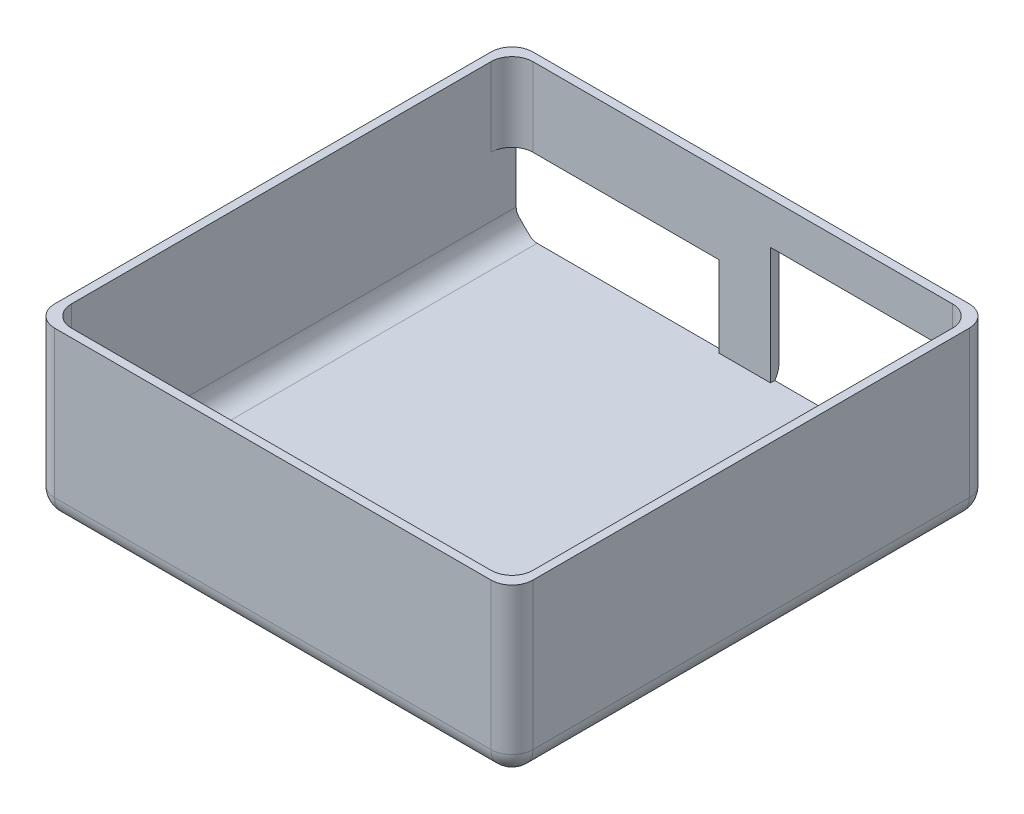
from build123d import *

# Parameters (mm, degrees)
SKETCH1_W           = 114
SKETCH1_H           = 114
SKETCH1_W_2         = 110
SKETCH1_H_2         = 110
BOSS_EXTRUDE1_DEPTH = 2
SKETCH1_3_W         = 114
SKETCH1_3_H         = 114
SKETCH1_3_W_2       = 110
SKETCH1_3_H_2       = 110
BOSS_EXTRUDE2_DEPTH = 40
SKETCH2_W           = 48.37766652
SKETCH2_H           = 27.964547649
SKETCH2_W_2         = 49.350090125
SKETCH2_H_2         = 19.287013153
CUT_EXTRUDE1_DEPTH  = 132.882523482
FILLET1_R           = 5
FILLET2_R           = 5


with BuildPart() as part:
    # Sketch1 → Boss-Extrude1 (new body)
    # profile 1 of 2: a face of its own
    with BuildSketch(Plane(origin=(0, 0, 0), x_dir=(1, 0, 0), z_dir=(0, 1, 0))):
        Rectangle(SKETCH1_W, SKETCH1_H)
        Rectangle(SKETCH1_W_2, SKETCH1_H_2, mode=Mode.SUBTRACT)
    # profile 2 of 2: a face of its own
    with BuildSketch(Plane(origin=(0, 0, 0), x_dir=(1, 0, 0), z_dir=(0, 1, 0))):
        Rectangle(SKETCH1_W_2, SKETCH1_H_2)
    extrude(amount=BOSS_EXTRUDE1_DEPTH)

    # Sketch1<3> → Boss-Extrude2 (add)
    with BuildSketch(Plane(origin=(0, 0, 0), x_dir=(1, 0, 0), z_dir=(0, 1, 0))):
        Rectangle(SKETCH1_3_W, SKETCH1_3_H)
        Rectangle(SKETCH1_3_W_2, SKETCH1_3_H_2, mode=Mode.SUBTRACT)
    extrude(amount=BOSS_EXTRUDE2_DEPTH)

    # Sketch2 → Cut-Extrude1 (cut, through all)
    with BuildSketch(Plane.XY.offset(-55)):
        with Locations((30.81116674, 15.982273825)):
            Rectangle(SKETCH2_W, SKETCH2_H)
        with Locations((-30.324954937, 11.643506577)):
            Rectangle(SKETCH2_W_2, SKETCH2_H_2)
    extrude(amount=-CUT_EXTRUDE1_DEPTH, mode=Mode.SUBTRACT)

    # Fillet1
    # the kernel refuses this fillet: 5 mm, written as the material it adds along each edge
    with BuildSketch(Plane(origin=(50, 7, 50), x_dir=(0, 0, 1), z_dir=(0, -1, 0))) as fillet1_piece_1_section:
        Polygon((0, 0), (FILLET1_R, 0), (FILLET1_R, -FILLET1_R), (0, -FILLET1_R), align=None)
    fillet1_piece_1 = extrude(amount=FILLET1_R, mode=Mode.PRIVATE)
    fillet1_piece_1 = fillet1_piece_1 - Plane(origin=(50, 7, 50), x_dir=(-0.7071067811865477, 0, -0.7071067811865475), z_dir=(0, -1, 0)) * Sphere(FILLET1_R, mode=Mode.PRIVATE)
    add(fillet1_piece_1)
    with BuildSketch(Plane(origin=(-50, 7, 50), x_dir=(-1, 0, 0), z_dir=(0, -1, 0))) as fillet1_piece_2_section:
        Polygon((0, 0), (FILLET1_R, 0), (FILLET1_R, -FILLET1_R), (0, -FILLET1_R), align=None)
    fillet1_piece_2 = extrude(amount=FILLET1_R, mode=Mode.PRIVATE)
    fillet1_piece_2 = fillet1_piece_2 - Plane(origin=(-50, 7, 50), x_dir=(0.7071067811865475, 0, -0.7071067811865476), z_dir=(0, -1, 0)) * Sphere(FILLET1_R, mode=Mode.PRIVATE)
    add(fillet1_piece_2)
    with BuildSketch(Plane(origin=(55, 2, 50), x_dir=(0, 1, 0), z_dir=(0, 0, -1)), Plane(origin=(-55, 2, -57), x_dir=(0, 1, 0), z_dir=(0, 0, 1))) as fillet1_piece_3:
        with BuildLine():
            CenterArc((FILLET1_R, -FILLET1_R), FILLET1_R, 90, 90)
            Line((0, -FILLET1_R), (0, 0))
            Line((0, 0), (FILLET1_R, 0))
        make_face()
    extrude(amount=107)
    with BuildSketch(Plane(origin=(50, 2, 55), x_dir=(0, 1, 0), z_dir=(-1, 0, 0))) as fillet1_piece_4:
        with BuildLine():
            CenterArc((FILLET1_R, FILLET1_R), FILLET1_R, 180, 90)
            Line((0, FILLET1_R), (0, 0))
            Line((0, 0), (FILLET1_R, 0))
        make_face()
    extrude(amount=100)
    with BuildSketch(Plane(origin=(-55, 7, 55), x_dir=(0, 0, -1), z_dir=(0, 1, 0)), Plane(origin=(55, 7, 55), x_dir=(-1, 0, 0), z_dir=(0, 1, 0))) as fillet1_piece_5:
        with BuildLine():
            CenterArc((FILLET1_R, -FILLET1_R), FILLET1_R, 90, 90)
            Line((0, -FILLET1_R), (0, 0))
            Line((0, 0), (FILLET1_R, 0))
        make_face()
    extrude(amount=33)
    with BuildSketch(Plane(origin=(55, 29.964547649, -55), x_dir=(-1, 0, 0), z_dir=(0, 1, 0))) as fillet1_piece_6:
        with BuildLine():
            CenterArc((FILLET1_R, FILLET1_R), FILLET1_R, 180, 90)
            Line((0, FILLET1_R), (0, 0))
            Line((0, 0), (FILLET1_R, 0))
        make_face()
    extrude(amount=10.035452351)
    with BuildSketch(Plane(origin=(-55, 21.287013153, -55), x_dir=(1, 0, 0), z_dir=(0, 1, 0))) as fillet1_piece_7:
        with BuildLine():
            CenterArc((FILLET1_R, -FILLET1_R), FILLET1_R, 90, 90)
            Line((0, -FILLET1_R), (0, 0))
            Line((0, 0), (FILLET1_R, 0))
        make_face()
    extrude(amount=18.712986847)
    # the kernel refuses this fillet: 5 mm, written as the material it takes off along each edge
    with BuildSketch(Plane(origin=(69.5, 0, 57), x_dir=(0, 0, -1), z_dir=(-1, 0, 0))) as fillet1_2_piece_1:
        with BuildLine():
            CenterArc((FILLET1_R, -FILLET1_R), FILLET1_R, 90, 90)
            Line((0, -FILLET1_R), (0, 0))
            Line((0, 0), (FILLET1_R, 0))
        make_face()
    extrude(amount=139, mode=Mode.SUBTRACT)
    with BuildSketch(Plane(origin=(-57, -12.5, 57), x_dir=(1, 0, 0), z_dir=(0, 1, 0)), Plane(origin=(57, 52.5, 57), x_dir=(-1, 0, 0), z_dir=(0, -1, 0))) as fillet1_2_piece_2:
        with BuildLine():
            CenterArc((FILLET1_R, FILLET1_R), FILLET1_R, 180, 90)
            Line((0, FILLET1_R), (0, 0))
            Line((0, 0), (FILLET1_R, 0))
        make_face()
    extrude(amount=65, mode=Mode.SUBTRACT)
    with BuildSketch(Plane(origin=(57, 52.5, -57), x_dir=(-1, 0, 0), z_dir=(0, -1, 0)), Plane(origin=(-57, -12.5, -57), x_dir=(1, 0, 0), z_dir=(0, 1, 0))) as fillet1_2_piece_3:
        with BuildLine():
            CenterArc((FILLET1_R, -FILLET1_R), FILLET1_R, 90, 90)
            Line((0, -FILLET1_R), (0, 0))
            Line((0, 0), (FILLET1_R, 0))
        make_face()
    extrude(amount=65, mode=Mode.SUBTRACT)

    # Fillet2
    # the kernel refuses this fillet: 5 mm, written as the material it takes off along each edge
    with BuildSketch(Plane(origin=(52, 5, 52), x_dir=(0, -1, 0), z_dir=(1, 0, 0))) as fillet2_piece_1_section:
        Polygon((0, 0), (FILLET2_R, 0), (FILLET2_R, -FILLET2_R), (0, -FILLET2_R), align=None)
    fillet2_piece_1 = extrude(amount=FILLET2_R, mode=Mode.PRIVATE)
    fillet2_piece_1 = fillet2_piece_1 - Plane(origin=(52, 5, 52), x_dir=(0, 0.7071067811865475, -0.7071067811865475), z_dir=(1, 0, 0)) * Sphere(FILLET2_R, mode=Mode.PRIVATE)
    add(fillet2_piece_1, mode=Mode.SUBTRACT)
    with BuildSketch(Plane(origin=(-52, 5, 52), x_dir=(0, -1, 0), z_dir=(-1, 0, 0))) as fillet2_piece_2_section:
        Polygon((0, 0), (FILLET2_R, 0), (FILLET2_R, FILLET2_R), (0, FILLET2_R), align=None)
    fillet2_piece_2 = extrude(amount=FILLET2_R, mode=Mode.PRIVATE)
    fillet2_piece_2 = fillet2_piece_2 - Plane(origin=(-52, 5, 52), x_dir=(0, 0.7071067811865475, -0.7071067811865475), z_dir=(-1, 0, 0)) * Sphere(FILLET2_R, mode=Mode.PRIVATE)
    add(fillet2_piece_2, mode=Mode.SUBTRACT)
    with BuildSketch(Plane(origin=(57, 0, -52), x_dir=(0, 1, 0), z_dir=(0, 0, 1)), Plane(origin=(-52, 0, -57), x_dir=(0, 1, 0), z_dir=(1, 0, 0)), Plane(origin=(-57, 0, 52), x_dir=(0, 1, 0), z_dir=(0, 0, -1))) as fillet2_piece_3:
        with BuildLine():
            CenterArc((FILLET2_R, FILLET2_R), FILLET2_R, 180, 90)
            Line((0, FILLET2_R), (0, 0))
            Line((0, 0), (FILLET2_R, 0))
        make_face()
    extrude(amount=104, mode=Mode.SUBTRACT)
    with BuildSketch(Plane(origin=(52, 0, -52), x_dir=(1, 0, 0), z_dir=(0, 0, 1))) as fillet2_piece_4:
        with BuildLine():
            CenterArc((5 - FILLET2_R, FILLET2_R), FILLET2_R, 270, 90)
            Line((5 - FILLET2_R, 0), (5, 0))
            Line((5, 0), (5, FILLET2_R))
        make_face()
    revolve(axis=Axis((52, 0, -52), (0, 1, 0)), revolution_arc=90, mode=Mode.SUBTRACT)
    with BuildSketch(Plane(origin=(-52, 0, -52), x_dir=(-1, 0, 0), z_dir=(0, 0, 1))) as fillet2_piece_5:
        with BuildLine():
            CenterArc((5 - FILLET2_R, -FILLET2_R), FILLET2_R, 0, 90)
            Line((5 - FILLET2_R, 0), (5, 0))
            Line((5, 0), (5, -FILLET2_R))
        make_face()
    revolve(axis=Axis((-52, 0, -52), (0, -1, 0)), revolution_arc=90, mode=Mode.SUBTRACT)


solid = part.part
